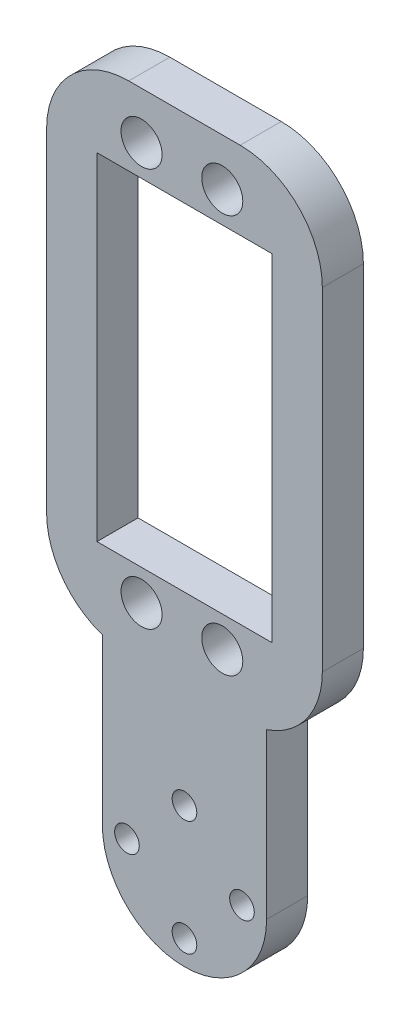
from build123d import *

# Parameters (mm, degrees)
BOSS_EXTRUDE1_DEPTH = 5
SKETCH2_R           = 1.5
CUT_EXTRUDE1_DEPTH  = 10
SKETCH4_W           = 33.56
SKETCH4_H           = 60
BOSS_EXTRUDE2_DEPTH = 5
FILLET1_R           = 10
SKETCH3_R           = 2.5
SKETCH3_W           = 21.3
SKETCH3_H           = 41
CUT_EXTRUDE2_DEPTH  = 5


with BuildPart() as part:
    # Sketch1 → Boss-Extrude1 (new body)
    with BuildSketch(Plane.XY):
        with BuildLine():
            Line((10, 0), (10, 80))
            Line((10, 80), (-10, 80))
            Line((-10, 80), (-10, 0))
            ThreePointArc((-10, 0), (0, -10), (10, 0))
        make_face()
    extrude(amount=BOSS_EXTRUDE1_DEPTH)

    # Sketch2 → Cut-Extrude1 (cut)
    with BuildSketch(Plane.XY.offset(5)):
        with Locations((0, 7)):
            Circle(SKETCH2_R)
        with Locations((7, 0)):
            Circle(SKETCH2_R)
        with Locations((0, -7)):
            Circle(SKETCH2_R)
        with Locations((-7, 0)):
            Circle(SKETCH2_R)
    extrude(amount=-CUT_EXTRUDE1_DEPTH, mode=Mode.SUBTRACT)

    # Sketch4 → Boss-Extrude2 (add)
    with BuildSketch(Plane.XY.offset(5)):
        with Locations((0, 50)):
            Rectangle(SKETCH4_W, SKETCH4_H)
    extrude(amount=-BOSS_EXTRUDE2_DEPTH)

    # Fillet1
    # the kernel refuses this fillet: 10 mm, written as the material it takes off along each edge
    with BuildSketch(Plane(origin=(16.78, 80, 30), x_dir=(-1, 0, 0), z_dir=(0, 0, -1)), Plane(origin=(-16.78, 80, 30), x_dir=(0, -1, 0), z_dir=(0, 0, -1))) as fillet1_piece_1:
        with BuildLine():
            CenterArc((FILLET1_R, -FILLET1_R), FILLET1_R, 90, 90)
            Line((0, -FILLET1_R), (-FILLET1_R * 0.02, -FILLET1_R))
            Line((-FILLET1_R * 0.02, -FILLET1_R), (-FILLET1_R * 0.02, FILLET1_R * 0.02))
            Line((-FILLET1_R * 0.02, FILLET1_R * 0.02), (FILLET1_R, FILLET1_R * 0.02))
            Line((FILLET1_R, FILLET1_R * 0.02), (FILLET1_R, 0))
        make_face()
    extrude(amount=55, mode=Mode.SUBTRACT)
    with BuildSketch(Plane(origin=(16.78, 20, 28.668491714), x_dir=(0, 1, 0), z_dir=(0, 0, -1))) as fillet1_piece_2:
        with BuildLine():
            CenterArc((9.467396685, -10), FILLET1_R, 90, 71.216080389)
            Line((0, -6.78), (-0.189347934, -6.7156))
            ThreePointArc((-0.189347934, -6.7156), (-0.2, -3.39), (-0.2, 0))
            Line((-0.2, 0), (0, 0.2))
            Line((0, 0.2), (9.467396685, 0.2))
            Line((9.467396685, 0.2), (9.467396685, 0))
        make_face()
    extrude(amount=52.336983427, mode=Mode.SUBTRACT)
    with BuildSketch(Plane(origin=(-16.78, 20, 28.668491714), x_dir=(1, 0, 0), z_dir=(0, 0, -1))) as fillet1_piece_3:
        with BuildLine():
            CenterArc((10, -9.467396685), FILLET1_R, 108.783919611, 71.216080389)
            Line((0, -9.467396685), (-0.2, -9.467396685))
            Line((-0.2, -9.467396685), (-0.2, 0))
            Line((-0.2, 0), (0, 0.2))
            ThreePointArc((0, 0.2), (3.39, 0.2), (6.7156, 0.189347934))
            Line((6.7156, 0.189347934), (6.78, 0))
        make_face()
    extrude(amount=52.336983427, mode=Mode.SUBTRACT)

    # Sketch3 → Cut-Extrude2 (cut)
    with BuildSketch(Plane.XY.offset(5)):
        with Locations((4.6, 74.25)):
            Circle(SKETCH3_R)
        with Locations((-5.22372371, 74.25)):
            Circle(SKETCH3_R)
        with Locations((-5.22372371, 25.75)):
            Circle(SKETCH3_R)
        with Locations((4.6, 25.75)):
            Circle(SKETCH3_R)
        with Locations((0, 50)):
            Rectangle(SKETCH3_W, SKETCH3_H)
    extrude(amount=-CUT_EXTRUDE2_DEPTH, mode=Mode.SUBTRACT)


solid = part.part
